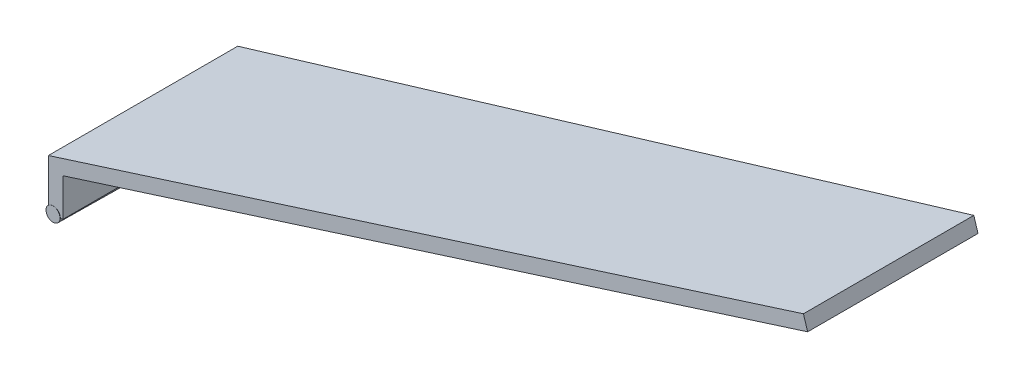
from build123d import *

# Parameters (mm, degrees)
DODANIE_WYCI_GNI_CIE1_DEPTH = 3.99238013
SZKIC2_W                    = 0.3
SZKIC2_H                    = 3.99238013
DODANIE_WYCI_GNI_CIE2_DEPTH = 0.8
POCHYLENIE1_ANGLE           = 17.213148567
POCHYLENIE2_ANGLE           = 0.727604838
SZKIC9_R                    = 0.150012096
DODANIE_WYCI_GNI_CIE3_DEPTH = 4


with BuildPart() as part:
    # Szkic1 → Dodanie-wyciągnięcie1 (new body)
    with BuildSketch(Plane(origin=(0, 0, -1.996190065), x_dir=(-1, 0, 0), z_dir=(0, 0, -1))):
        Polygon((-17.028297213, 0.8), (0.3, 0.8), (0.3, 1.021125946), (-15.448300877, 5.9), align=None)
    extrude(amount=-DODANIE_WYCI_GNI_CIE1_DEPTH)

    # Szkic2 → Dodanie-wyciągnięcie2 (add)
    with BuildSketch(Plane.XZ.offset(-0.8)):
        with Locations((-0.15, 0)):
            Rectangle(SZKIC2_W, SZKIC2_H)
    extrude(amount=DODANIE_WYCI_GNI_CIE2_DEPTH)

    # Pochylenie1
    pochylenie1_faces = [part.faces().sort_by_distance(p)[0] for p in [
        (8.514148606, 0.8, 0),
    ]]
    draft(pochylenie1_faces, Plane(origin=(0, 0, 1.996190065), x_dir=(0, 1, 0), z_dir=(1, 0, 0)), POCHYLENIE1_ANGLE)

    # Pochylenie2
    pochylenie2_faces = [part.faces().sort_by_distance(p)[0] for p in [
        (7.25883575, 3.182414197, -1.996190065),
        (7.25883575, 3.182414197, 1.996190065),
    ]]
    draft(pochylenie2_faces, Plane(origin=(0, 0, 1.996190065), x_dir=(0, 1, 0), z_dir=(1, 0, 0)), POCHYLENIE2_ANGLE)

    # Szkic9 → Dodanie-wyciągnięcie3 (add)
    with BuildSketch(Plane(origin=(0.025347092, 0, -1.995868163), x_dir=(-0.9999193675123561, 0, -0.012698758746029219), z_dir=(0.01269875874602922, 0, -0.9999193675123562))):
        with Locations((0.175361232, 0)):
            Circle(SZKIC9_R)
    extrude(amount=-DODANIE_WYCI_GNI_CIE3_DEPTH)


solid = part.part
